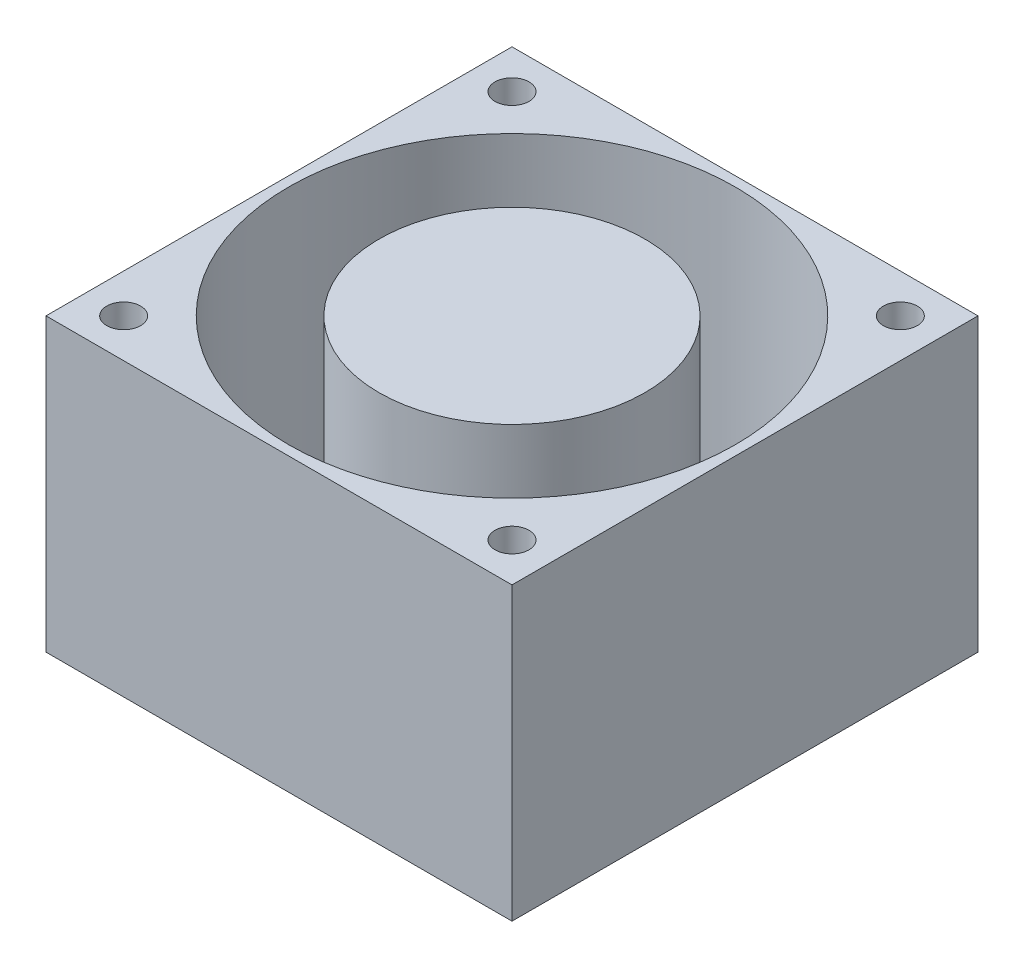
from build123d import *

# Parameters (mm, degrees)
SKETCH1_W             = 60.96
SKETCH1_H             = 60.96
SKETCH1_R             = 29.21
SKETCH1_R_2           = 2.2225
BOSS_EXTRUDE1_DEPTH   = 38.1
SKETCH1_R_3           = 17.399
BOSS_EXTRUDE1_2_DEPTH = 38.1
BOSS_EXTRUDE2_DEPTH   = 2.54


with BuildPart() as part:
    # Sketch1 → Boss-Extrude1 (new body)
    with BuildSketch(Plane(origin=(0, 0, 0), x_dir=(1, 0, 0), z_dir=(0, 1, 0))):
        Rectangle(SKETCH1_W, SKETCH1_H)
        Circle(SKETCH1_R, mode=Mode.SUBTRACT)
        with Locations((25.4, -25.4)):
            Circle(SKETCH1_R_2, mode=Mode.SUBTRACT)
        with Locations((25.4, 25.4)):
            Circle(SKETCH1_R_2, mode=Mode.SUBTRACT)
        with Locations((-25.4, -25.4)):
            Circle(SKETCH1_R_2, mode=Mode.SUBTRACT)
        with Locations((-25.4, 25.4)):
            Circle(SKETCH1_R_2, mode=Mode.SUBTRACT)
    extrude(amount=BOSS_EXTRUDE1_DEPTH)



with BuildPart() as body_2:
    # Sketch1 → Boss-Extrude1 2 (new body)
    with BuildSketch(Plane(origin=(0, 0, 0), x_dir=(1, 0, 0), z_dir=(0, 1, 0))):
        Circle(SKETCH1_R_3)
    extrude(amount=BOSS_EXTRUDE1_2_DEPTH)


with BuildPart() as part_1:
    add(part.part)

    add(body_2.part)  # Boss-Extrude2 merges body 2
    # Sketch2 → Boss-Extrude2 (add)
    with BuildSketch(Plane.XZ):
        with BuildLine():
            ThreePointArc((-17.352587732, -1.27), (-17.399, 0), (-17.352587732, 1.27))
            Line((-17.352587732, 1.27), (-30.48, 1.27))
            Line((-30.48, 1.27), (-30.48, -1.27))
            Line((-30.48, -1.27), (-17.352587732, -1.27))
        make_face()
        with BuildLine():
            Line((-10.626679764, 28.595751034), (-6.570086281, 16.110840054))
            ThreePointArc((-6.570086281, 16.110840054), (-5.376586685, 16.547432327), (-4.15440273, 16.89574322))
            Line((-4.15440273, 16.89574322), (-8.210996213, 29.3806542))
            Line((-8.210996213, 29.3806542), (-10.626679764, 28.595751034))
        make_face()
        with BuildLine():
            ThreePointArc((-4.15440273, -16.89574322), (-5.376586685, -16.547432327), (-6.570086281, -16.110840054))
            Line((-6.570086281, -16.110840054), (-10.626679764, -28.595751034))
            Line((-10.626679764, -28.595751034), (-8.210996213, -29.3806542))
            Line((-8.210996213, -29.3806542), (-4.15440273, -16.89574322))
        make_face()
        with BuildLine():
            Line((23.912350718, 18.943146073), (13.292051101, 11.227046741))
            ThreePointArc((13.292051101, 11.227046741), (14.076086685, 10.226875605), (14.785025642, 9.172143575))
            Line((14.785025642, 9.172143575), (25.405325259, 16.888242907))
            Line((25.405325259, 16.888242907), (23.912350718, 18.943146073))
        make_face()
        with BuildLine():
            ThreePointArc((14.785025642, -9.172143575), (14.076086685, -10.226875605), (13.292051101, -11.227046741))
            Line((13.292051101, -11.227046741), (23.912350718, -18.943146073))
            Line((23.912350718, -18.943146073), (25.405325259, -16.888242907))
            Line((25.405325259, -16.888242907), (14.785025642, -9.172143575))
        make_face()
    extrude(amount=-BOSS_EXTRUDE2_DEPTH)


solid = part_1.part
